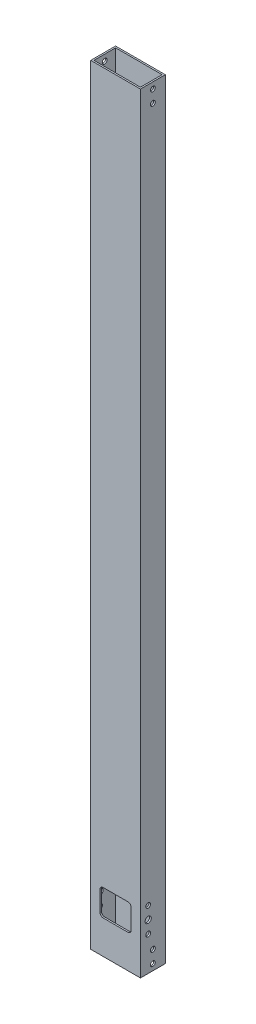
from build123d import *

# Parameters (mm, degrees)
SKETCH1_W               = 50.8
SKETCH1_H               = 787.4
BOSS_EXTRUDE1_DEPTH     = 12.7
SHELL1_T                = -1.5875
SKETCH3_R               = 2.4892
CUT_EXTRUDE1_DEPTH      = 395.722864805
CUT_EXTRUDE2_DEPTH      = 395.722864805
CUT_EXTRUDE2_DEPTH_BACK = 395.722864805
SKETCH4_R               = 3.175
SKETCH4_R_2             = 2.4892
SKETCH5_W               = 31.75
SKETCH5_H               = 26.9875
CUT_EXTRUDE3_DEPTH      = 395.722864805
FILLET1_R               = 3.175


with BuildPart() as part:
    # Sketch1 → Boss-Extrude1 (new, symmetric)
    with BuildSketch(Plane.XY):
        Rectangle(SKETCH1_W, SKETCH1_H)
    extrude(amount=BOSS_EXTRUDE1_DEPTH, both=True)

    # Shell1
    shell1_openings = [part.faces().sort_by_distance(p)[0] for p in [
        (0, -393.7, 0),
        (0, 393.7, 0),
    ]]
    offset(amount=SHELL1_T, openings=shell1_openings, kind=Kind.INTERSECTION)

    # Sketch3 → Cut-Extrude1 (cut, symmetric)
    with BuildSketch(Plane(origin=(0, 0, 0), x_dir=(0, 0, -1), z_dir=(1, 0, 0))):
        with Locations((0, -387.35)):
            Circle(SKETCH3_R)
        with Locations((0, -374.65)):
            Circle(SKETCH3_R)
    cut_extrude1 = extrude(amount=CUT_EXTRUDE1_DEPTH, both=True, mode=Mode.SUBTRACT)

    # Sketch4 → Cut-Extrude2 (cut, two sides: drawn at the far end of the back side and taken through both)
    with BuildSketch(Plane(origin=(0, 0, 0), x_dir=(0, 0, -1), z_dir=(1, 0, 0)).offset(-CUT_EXTRUDE2_DEPTH_BACK)):
        with Locations((-4.7625, -346.075)):
            Circle(SKETCH4_R)
        with Locations((-4.7625, -333.375)):
            Circle(SKETCH4_R_2)
        with Locations((-4.7625, -358.775)):
            Circle(SKETCH4_R_2)
    extrude(amount=CUT_EXTRUDE2_DEPTH + CUT_EXTRUDE2_DEPTH_BACK, mode=Mode.SUBTRACT)

    # Mirror1: Cut-Extrude1 across plane
    add(cut_extrude1.mirror(Plane.ZX), mode=Mode.SUBTRACT)

    # Sketch5 → Cut-Extrude3 (cut, through all)
    with BuildSketch(Plane.XY):
        with Locations((0, -346.075)):
            Rectangle(SKETCH5_W, SKETCH5_H)
    extrude(amount=CUT_EXTRUDE3_DEPTH, mode=Mode.SUBTRACT)

    # Fillet1
    fillet1_edges = [part.edges().sort_by_distance(p)[0] for p in [
        (-15.875, -359.56875, 11.90625),
        (15.875, -359.56875, 11.90625),
        (-15.875, -332.58125, 11.90625),
        (15.875, -332.58125, 11.90625),
    ]]
    fillet(fillet1_edges, radius=FILLET1_R)


solid = part.part
